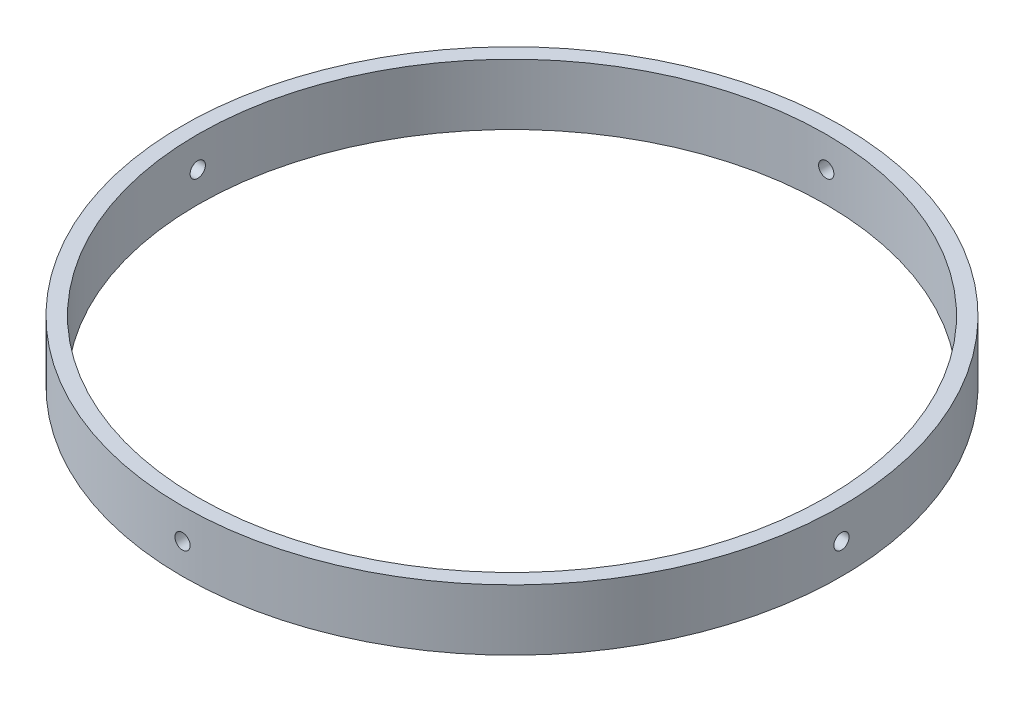
from build123d import *

# Parameters (mm, degrees)
SKETCH1_R               = 68.707
SKETCH1_R_2             = 65.532
BOSS_EXTRUDE1_DEPTH     = 12.7
CUT_EXTRUDE1_REACH      = 99.993
CUT_EXTRUDE1_END_RADIUS = 68.707
SKETCH2_R               = 1.5875
CIRPATTERN1_COUNT       = 4


with BuildPart() as part:
    # Sketch1 → Boss-Extrude1 (new body)
    with BuildSketch(Plane(origin=(0, 0, 0), x_dir=(1, 0, 0), z_dir=(0, 1, 0))):
        Circle(SKETCH1_R)
        Circle(SKETCH1_R_2, mode=Mode.SUBTRACT)
    extrude(amount=BOSS_EXTRUDE1_DEPTH)

    # Cut-Extrude1: up to this cylinder (the profile starts inside it)
    cut_extrude1_end = Plane(origin=(0, 6.35, 0), z_dir=(0, -1, 0)) * Cylinder(CUT_EXTRUDE1_END_RADIUS, 338.4, mode=Mode.PRIVATE)
    # Sketch2 → Cut-Extrude1 (cut, up to the surface)
    with BuildSketch(Plane.XY, mode=Mode.PRIVATE) as cut_extrude1_sk1:
        with Locations((0, 6.35)):
            Circle(SKETCH2_R)
    cut_extrude1_tool1 = extrude(cut_extrude1_sk1.sketch, amount=-CUT_EXTRUDE1_REACH, mode=Mode.PRIVATE) & cut_extrude1_end
    cut_extrude1 = cut_extrude1_tool1.solids().sort_by_distance((0, 6.35, 0))[0]
    add(cut_extrude1, mode=Mode.SUBTRACT)

    # CirPattern1: Cut-Extrude1 ×4 about axis
    cirpattern1_axis = Axis((0, 12.7, 0), (0, -1, 0))
    for i in range(1, CIRPATTERN1_COUNT):
        add(cut_extrude1.rotate(cirpattern1_axis, i * 360 / CIRPATTERN1_COUNT), mode=Mode.SUBTRACT)


solid = part.part
